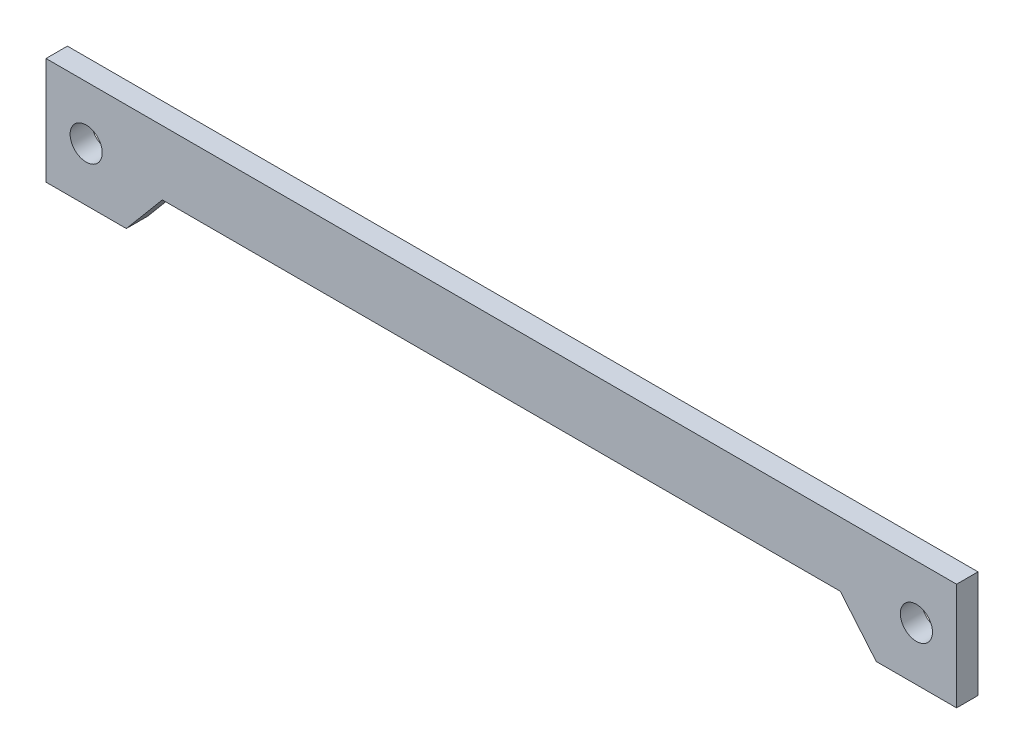
from build123d import *

# Parameters (mm, degrees)
GRUNDPLATTE_DEPTH               = 4
SKIZZE2_R                       = 3
SCHNITT_LINEAR_AUSTRAGEN1_DEPTH = 88.412813706


with BuildPart() as part:
    # Skizze1 → Grundplatte (new body)
    with BuildSketch(Plane.XY):
        Polygon((85, 0), (-85, 0), (-85, -20), (-70, -20), (-63.287202951, -12), (63.287202951, -12), (70, -20), (85, -20), align=None)
    extrude(amount=GRUNDPLATTE_DEPTH)

    # Skizze2 → Schnitt-Linear austragen1 (cut, through all)
    with BuildSketch(Plane.XY.offset(4)):
        with Locations((-77.5, -10)):
            Circle(SKIZZE2_R)
        with Locations((77.5, -10)):
            Circle(SKIZZE2_R)
    extrude(amount=-SCHNITT_LINEAR_AUSTRAGEN1_DEPTH, mode=Mode.SUBTRACT)


solid = part.part
